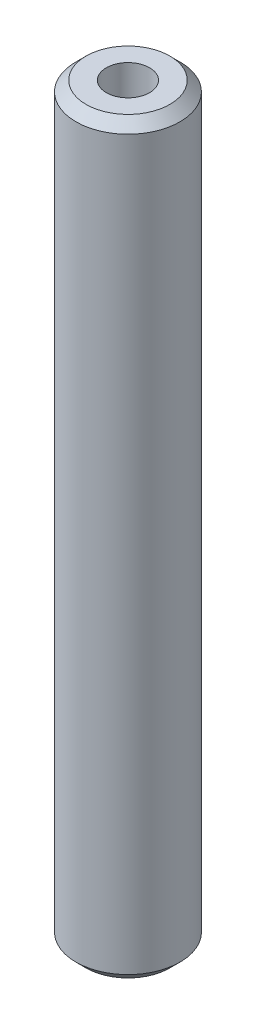
from build123d import *

# Parameters (mm, degrees)
SKETCH1_R           = 12.5
BOSS_EXTRUDE1_DEPTH = 179.890282558
SKETCH2_R           = 5.202979288
CUT_EXTRUDE1_DEPTH  = 181.756780671
CHAMFER1_SIZE       = 2.418806631


with BuildPart() as part:
    # Sketch1 → Boss-Extrude1 (new body)
    with BuildSketch(Plane(origin=(0, 0, 0), x_dir=(1, 0, 0), z_dir=(0, 1, 0))):
        Circle(SKETCH1_R)
    extrude(amount=BOSS_EXTRUDE1_DEPTH)

    # Sketch2 → Cut-Extrude1 (cut, through all)
    with BuildSketch(Plane(origin=(0, 0, 0), x_dir=(1, 0, 0), z_dir=(0, 1, 0))):
        Circle(SKETCH2_R)
    extrude(amount=CUT_EXTRUDE1_DEPTH, mode=Mode.SUBTRACT)

    # Chamfer1
    chamfer1_edges = [part.edges().sort_by_distance(p)[0] for p in [
        (-12.5, 179.890282558, 0),
        (-12.5, 0, 0),
    ]]
    chamfer(chamfer1_edges, length=CHAMFER1_SIZE)


solid = part.part
